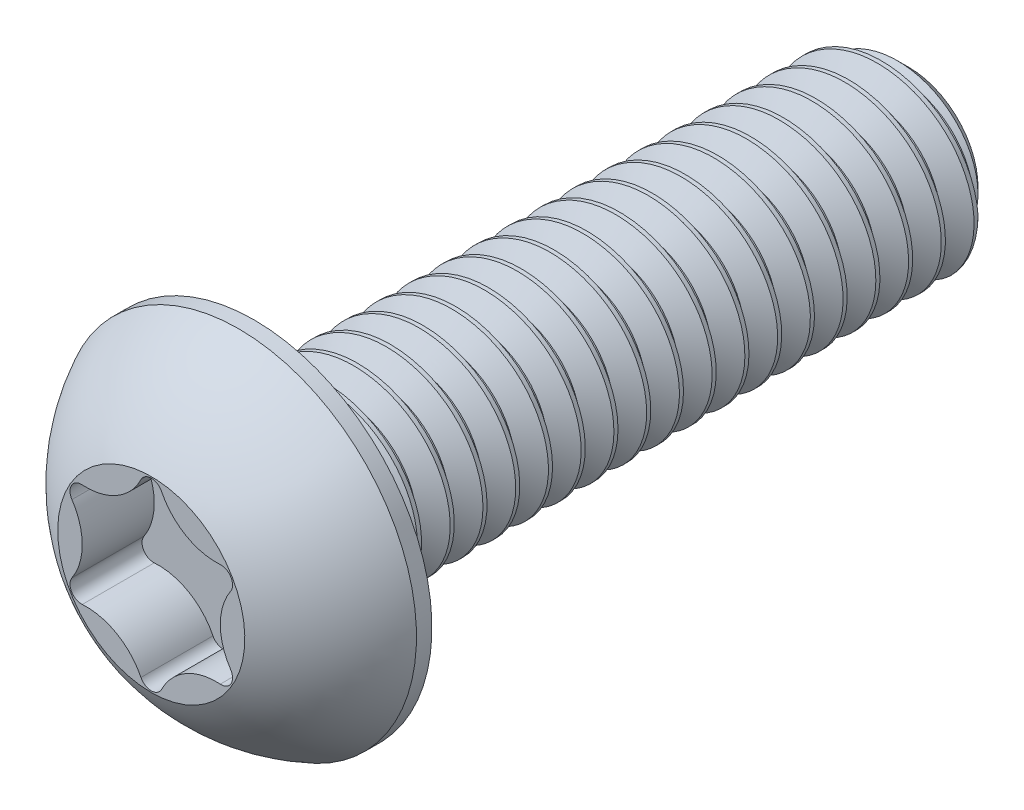
from build123d import *

# Parameters (mm, degrees)
SKETCH12_W         = 14
SKETCH12_H         = 2
CUT_EXTRUDE4_DEPTH = 1.54
CIRPATTERN1_COUNT  = 6
CHAMFER1_SIZE      = 0.525
CUT_SWEEP1_PITCH   = 0.7
CUT_SWEEP1_TO      = 14


with BuildPart() as part:
    # Sketch12 → Revolve1 (revolve)
    with BuildSketch(Plane(origin=(0, 0, 0), x_dir=(0, 0, -1), z_dir=(1, 0, 0))):
        with Locations((0, 1)):
            Rectangle(SKETCH12_W, SKETCH12_H)
    revolve(axis=Axis((0, 0, -7), (0, 0, 1)))

    # Sketch7 → Revolve2 (revolve)
    with BuildSketch(Plane(origin=(0, 0, 0), x_dir=(0, 0, -1), z_dir=(1, 0, 0)), mode=Mode.PRIVATE) as revolve2_sk:
        with BuildLine():
            Line((-7.33, 3.8), (-7, 3.8))
            Line((-7, 3.8), (-7, 0))
            Line((-7, 0), (-9.2, 0))
            Line((-9.2, 0), (-9.2, 2))
            ThreePointArc((-9.2, 2), (-8.406499853, 3.047002626), (-7.33, 3.8))
        make_face()
    revolve(revolve2_sk.sketch.rotate(Axis((0, 0, 9.2), (0, 0, -1)), 180), axis=Axis((0, 0, 9.2), (0, 0, -1)))

    # Sketch11 → Cut-Extrude4 (cut)
    with BuildSketch(Plane.XY.offset(9.2)):
        with BuildLine():
            Line((0, 0), (-1.704771007, 0.98425))
            ThreePointArc((-1.704771007, 0.98425), (-1.737604406, 0.853137928), (-1.696234895, 0.724464034))
            ThreePointArc((-1.696234895, 0.724464034), (-1.476375, 0), (-1.696234895, -0.724464034))
            ThreePointArc((-1.696234895, -0.724464034), (-1.737604406, -0.853137928), (-1.704771007, -0.98425))
            Line((-1.704771007, -0.98425), (0, 0))
        make_face()
    cut_extrude4 = extrude(amount=-CUT_EXTRUDE4_DEPTH, mode=Mode.SUBTRACT)

    # CirPattern1: Cut-Extrude4 ×6 about axis
    cirpattern1_axis = Axis((0, 0, 0), (0, 0, -1))
    for i in range(1, CIRPATTERN1_COUNT):
        add(cut_extrude4.rotate(cirpattern1_axis, i * 360 / CIRPATTERN1_COUNT), mode=Mode.SUBTRACT)

    # Chamfer1
    chamfer1_edges = [part.edges().sort_by_distance(p)[0] for p in [
        (0, -2, -7),
    ]]
    chamfer(chamfer1_edges, length=CHAMFER1_SIZE)


with BuildPart() as body_2:
    # Split1: read off the stored shape, not the designer's step
    # Split1: the piece on the far side of the plane
    add(part.part)
    split(bisect_by=Plane.XY.offset(7), keep=Keep.BOTTOM)

    # Cut-Sweep1: arcs per turn and ends read off the stored shape
    # Cut-Sweep1: the profile of Sketch14 screwed along a right-hand helix through 21 turns, 6 arcs to a turn; built about Z, then put on its axis
    cut_sweep1_z = Axis((0, 0, 0), (0, 0, 1))
    cut_sweep1_corners = [(1.545336663, 0, -0.2625), (2.037888611, 0, 0.021875), (2.037888611, 0, -0.634375), (1.545336663, 0, -0.35)]
    with BuildLine(mode=Mode.PRIVATE) as cut_sweep1_profile:
        Line(cut_sweep1_corners[0], cut_sweep1_corners[1])
        Line(cut_sweep1_corners[1], cut_sweep1_corners[2])
        Line(cut_sweep1_corners[2], cut_sweep1_corners[3])
        Line(cut_sweep1_corners[3], cut_sweep1_corners[0])
    cut_sweep1_cap = Face(cut_sweep1_profile.wire())
    cut_sweep1_turn_angles = [0, 30, 60, 90, 120, 150, 180, 210, 240, 270, 300, 330, 360]
    cut_sweep1_turn_weights = [1, 0.8660254037844387, 1, 0.8660254037844387, 1, 0.8660254037844387, 1, 0.8660254037844387, 1, 0.8660254037844387, 1, 0.8660254037844387, 1]
    cut_sweep1_turn_rails = [Edge.make_bspline([Vector(p[0], p[1], 0).rotate(cut_sweep1_z, cut_sweep1_turn_angles[k]) / cut_sweep1_turn_weights[k] + Vector(0, 0, p[2] + CUT_SWEEP1_PITCH * cut_sweep1_turn_angles[k] / 360) for k in range(13)], [0, 0, 0, 1, 1, 2, 2, 3, 3, 4, 4, 5, 5, 6, 6, 6], 2, cut_sweep1_turn_weights) for p in cut_sweep1_corners]
    cut_sweep1_turn_sides = [Face.make_surface_from_curves(cut_sweep1_turn_rails[p[0]], cut_sweep1_turn_rails[p[1]]) for p in [(0, 1), (1, 2), (2, 3), (3, 0)]]
    cut_sweep1 = Plane(origin=(0, 0, -7), x_dir=(0, 1, 0), z_dir=(0, 0, 1)) * split(Solid(Shell([*[p.moved(Location((0, 0, CUT_SWEEP1_PITCH * i))) for i in range(21) for p in cut_sweep1_turn_sides], cut_sweep1_cap, cut_sweep1_cap.rotate(cut_sweep1_z, 7560).moved(Location((0, 0, CUT_SWEEP1_PITCH * 7560 / 360)))])), bisect_by=Plane.XY.offset(CUT_SWEEP1_TO), keep=Keep.BOTTOM, mode=Mode.PRIVATE)
    add(cut_sweep1, mode=Mode.SUBTRACT)


with BuildPart() as part_1:
    add(part.part)

    # Split1
    split(bisect_by=Plane.XY.offset(7), keep=Keep.TOP)

    # Combine1: union body 2
    add(body_2.part)


solid = part_1.part
